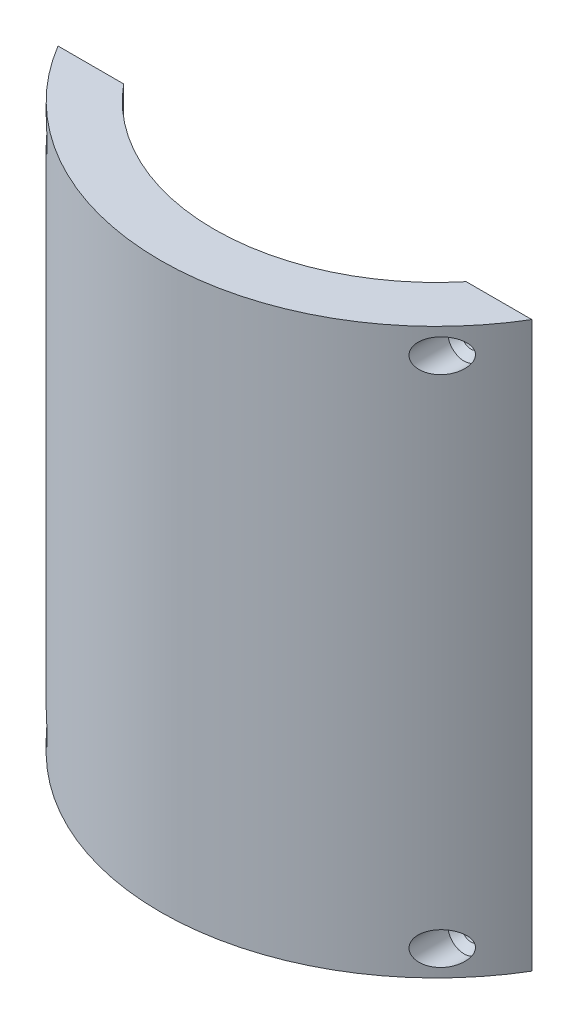
from build123d import *

# Parameters (mm, degrees)
BOSS_EXTRUDE1_DEPTH = 100


with BuildPart() as part:
    # Sketch1 → Boss-Extrude1 (new body)
    with BuildSketch(Plane(origin=(0, 0, 0), x_dir=(1, 0, 0), z_dir=(0, 1, 0))):
        with BuildLine():
            ThreePointArc((30.348758021, -25.07), (0, -39.364349524), (-30.348758021, -25.07))
            Line((-30.348758021, -25.07), (-41.978758021, -25.07))
            ThreePointArc((-41.978758021, -25.07), (0, -48.895), (41.978758021, -25.07))
            Line((41.978758021, -25.07), (30.348758021, -25.07))
        make_face()
    extrude(amount=BOSS_EXTRUDE1_DEPTH)

    # Sketch6 → Cut-Revolve4 (revolve, cut)
    with BuildSketch(Plane(origin=(34.962080117, 4.5125, 25.07), x_dir=(-1, 0, 0), z_dir=(0, -1, 0))):
        Polygon((0, 1.685394277), (0, -4.78184701), (0, -15.185924704), (-2.9, -15.185924704), (-2.9, -4.968389004), (-1.65, -3.771328265), (-1.65, 1.685394277), align=None)
    cut_revolve4 = revolve(axis=Axis((34.962080117, 4.5125, 23.384605723), (0, 0, 1)), mode=Mode.SUBTRACT)

    # Mirror1: Cut-Revolve4 across plane
    add(cut_revolve4.mirror(Plane(origin=(0, 50, 0), x_dir=(0, 0, 1), z_dir=(0, -1, 0))), mode=Mode.SUBTRACT)

    # Mirror1 at the second plane: Cut-Revolve4 across plane
    add(cut_revolve4.mirror(Plane(origin=(0, 0, 0), x_dir=(0, 0, 1), z_dir=(1, 0, 0))), mode=Mode.SUBTRACT)

    # Mirror1 at the second plane copy 1 sketc → Mirror1 at the second plane copy 1 (revolve, cut)
    with BuildSketch(Plane(origin=(-34.962080117, 95.4875, 25.07), x_dir=(1, 0, 0), z_dir=(0, 1, 0))):
        Polygon((0, 1.685394277), (0, -4.78184701), (0, -15.185924704), (-2.9, -15.185924704), (-2.9, -4.968389004), (-1.65, -3.771328265), (-1.65, 1.685394277), align=None)
    revolve(axis=Axis((-34.962080117, 95.4875, 23.384605723), (0, 0, 1)), mode=Mode.SUBTRACT)


solid = part.part
